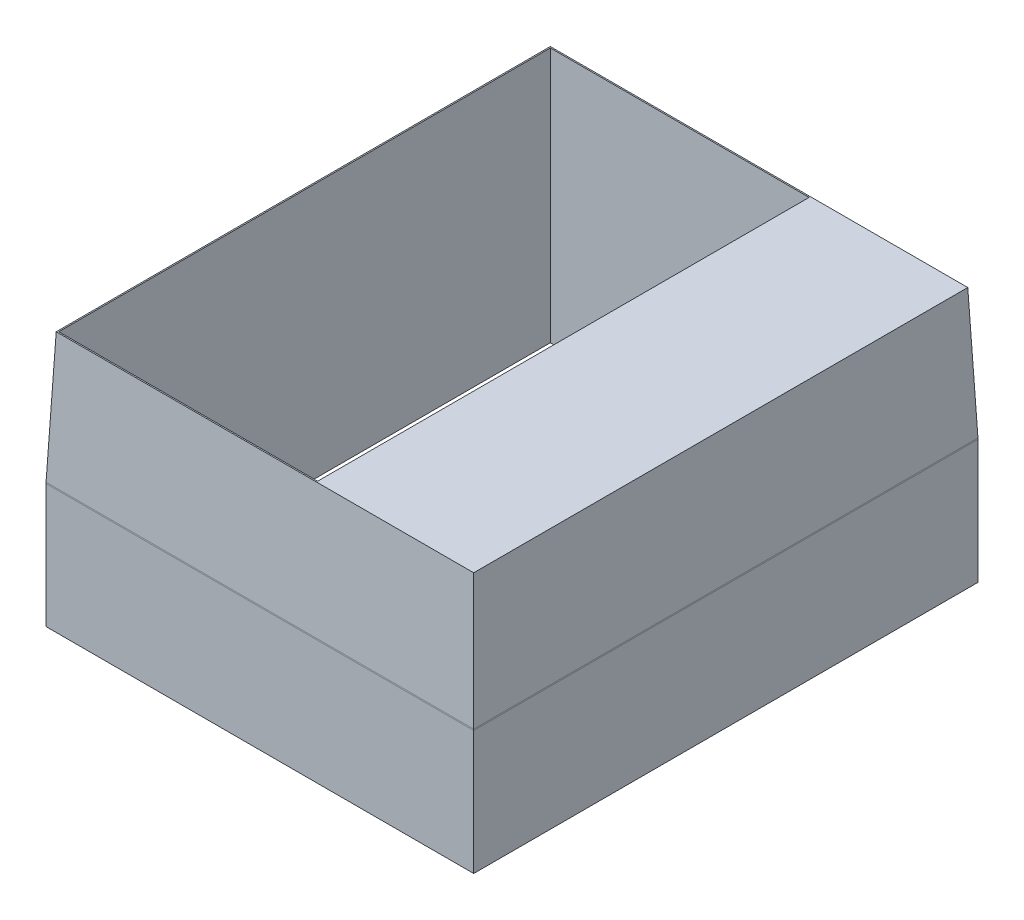
from build123d import *
from OCP.BRepFilletAPI import BRepFilletAPI_MakeChamfer

# Parameters (mm, degrees)
SKIZZE1_W                       = 67
SKIZZE1_H                       = 79
SKIZZE1_W_2                     = 40.55
SKIZZE1_H_2                     = 77
AUFSATZ_LINEAR_AUSTRAGEN2_DEPTH = 40
FASE1_SIZE                      = 20.5
FASE1_SIZE2                     = 0.8
VERRUNDUNG2_R                   = 5


with BuildPart() as part:
    # Skizze1 → Aufsatz-Linear austragen2 (new body)
    with BuildSketch(Plane(origin=(0, 0, 0), x_dir=(1, 0, 0), z_dir=(0, 1, 0))):
        with Locations((32.5, 38.5)):
            Rectangle(SKIZZE1_W, SKIZZE1_H)
        with Locations((20.275, 38.5)):
            Rectangle(SKIZZE1_W_2, SKIZZE1_H_2, mode=Mode.SUBTRACT)
    extrude(amount=AUFSATZ_LINEAR_AUSTRAGEN2_DEPTH)

    # Fase1: one chamfer whose edges measure the first distance from different faces: ONE call of the kernel's chamfer builder (chamfer() names one face for all edges)
    fase1_edges_1 = [part.edges().sort_by_distance(p)[0] for p in [
        (66, 40, -38.5),
    ]]
    fase1_side_1 = [part.faces().sort_by_distance(p)[0] for p in [
        (66, 20, -38.5),
    ]]
    fase1_edges_2 = [part.edges().sort_by_distance(p)[0] for p in [
        (32.5, 40, -78),
    ]]
    fase1_side_2 = [part.faces().sort_by_distance(p)[0] for p in [
        (32.5, 20, -78),
    ]]
    fase1_edges_3 = [part.edges().sort_by_distance(p)[0] for p in [
        (-1, 40, -38.5),
    ]]
    fase1_side_3 = [part.faces().sort_by_distance(p)[0] for p in [
        (-1, 20, -38.5),
    ]]
    fase1_edges_4 = [part.edges().sort_by_distance(p)[0] for p in [
        (32.5, 40, 1),
    ]]
    fase1_side_4 = [part.faces().sort_by_distance(p)[0] for p in [
        (32.5, 20, 1),
    ]]
    fase1 = BRepFilletAPI_MakeChamfer(part.part.solid().wrapped)
    for e in fase1_edges_1:
        fase1.Add(FASE1_SIZE, FASE1_SIZE2, e.wrapped, fase1_side_1[0].wrapped)  # the first distance lies on this face
    for e in fase1_edges_2:
        fase1.Add(FASE1_SIZE, FASE1_SIZE2, e.wrapped, fase1_side_2[0].wrapped)  # the first distance lies on this face
    for e in fase1_edges_3:
        fase1.Add(FASE1_SIZE, FASE1_SIZE2, e.wrapped, fase1_side_3[0].wrapped)  # the first distance lies on this face
    for e in fase1_edges_4:
        fase1.Add(FASE1_SIZE, FASE1_SIZE2, e.wrapped, fase1_side_4[0].wrapped)  # the first distance lies on this face
    add(Compound.cast(fase1.Shape()), mode=Mode.REPLACE)

    # Verrundung2
    # the kernel refuses this fillet: 5 mm, written as the material it takes off along each edge
    with BuildSketch(Plane(origin=(-1.24380965, 19.5, -78), x_dir=(0, -1, 0), z_dir=(1, 0, 0)), Plane(origin=(66.24380965, 19.5, 1), x_dir=(0, -1, 0), z_dir=(-1, 0, 0))) as verrundung2_piece_1:
        with BuildLine():
            CenterArc((VERRUNDUNG2_R * 0.019504771978, -VERRUNDUNG2_R), VERRUNDUNG2_R, 90, 2.234798859)
            Line((-VERRUNDUNG2_R * 0.0194899369818, -VERRUNDUNG2_R * 0.000760582906605), (0, 0))
            Line((0, 0), (VERRUNDUNG2_R * 0.019504771978, 0))
        make_face()
    extrude(amount=67.487619299, mode=Mode.SUBTRACT)
    with BuildSketch(Plane(origin=(66, 19.5, -78.24380965), x_dir=(0, -1, 0), z_dir=(0, 0, 1)), Plane(origin=(-1, 19.5, 1.24380965), x_dir=(0, -1, 0), z_dir=(0, 0, -1))) as verrundung2_piece_2:
        with BuildLine():
            CenterArc((VERRUNDUNG2_R * 0.019504771978, -VERRUNDUNG2_R), VERRUNDUNG2_R, 90, 2.234798859)
            Line((-VERRUNDUNG2_R * 0.0194899369818, -VERRUNDUNG2_R * 0.000760582906605), (0, 0))
            Line((0, 0), (VERRUNDUNG2_R * 0.019504771978, 0))
        make_face()
    extrude(amount=79.487619299, mode=Mode.SUBTRACT)


solid = part.part
